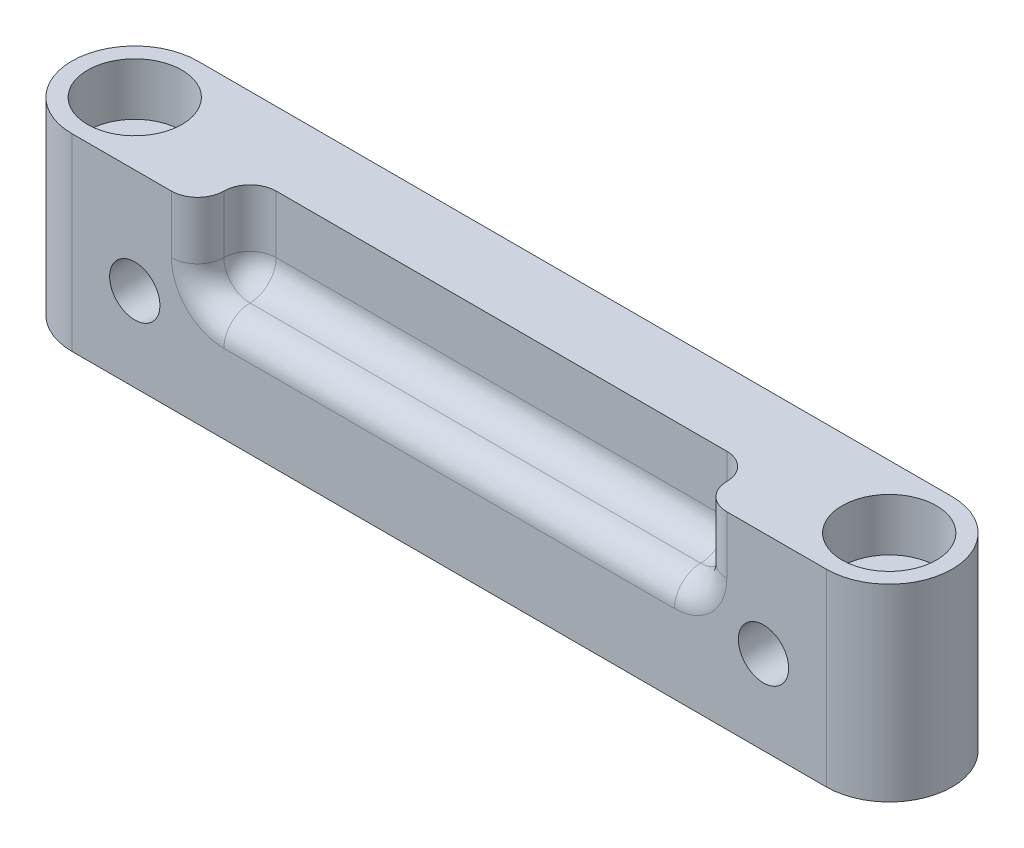
from build123d import *

# Parameters (mm, degrees)
SKETCH1_R           = 2.4
BOSS_EXTRUDE1_DEPTH = 9
SKETCH2_R           = 4.5
CUT_EXTRUDE1_DEPTH  = 5
SKETCH3_W           = 48
SKETCH3_H           = 5
CUT_EXTRUDE2_DEPTH  = 8
FILLET1_R           = 2.5
SKETCH4_R           = 2.4
CUT_EXTRUDE3_DEPTH  = 45.598206242


with BuildPart() as part:
    # Sketch1 → Boss-Extrude1 (new, symmetric)
    with BuildSketch(Plane(origin=(0, 0, 0), x_dir=(1, 0, 0), z_dir=(0, 1, 0))):
        with BuildLine():
            Line((36, -6), (-36, -6))
            ThreePointArc((-36, -6), (-42, 0), (-36, 6))
            Line((-36, 6), (36, 6))
            ThreePointArc((36, 6), (42, 0), (36, -6))
        make_face()
        with Locations(Location((-36, 0, 0), (0, 0, 270))):
            Circle(SKETCH1_R, mode=Mode.SUBTRACT)
        with Locations(Location((36, 0, 0), (0, 0, 270))):
            Circle(SKETCH1_R, mode=Mode.SUBTRACT)
    extrude(amount=BOSS_EXTRUDE1_DEPTH, both=True)

    # Sketch2 → Cut-Extrude1 (cut)
    with BuildSketch(Plane(origin=(0, 9, 0), x_dir=(1, 0, 0), z_dir=(0, 1, 0))):
        with Locations(Location((-36, 0, 0), (0, 0, 270))):
            Circle(SKETCH2_R)
        with Locations(Location((36, 0, 0), (0, 0, 270))):
            Circle(SKETCH2_R)
    extrude(amount=-CUT_EXTRUDE1_DEPTH, mode=Mode.SUBTRACT)

    # Sketch3 → Cut-Extrude2 (cut)
    with BuildSketch(Plane(origin=(0, 9, 0), x_dir=(1, 0, 0), z_dir=(0, 1, 0))):
        with Locations((0, -3.5)):
            Rectangle(SKETCH3_W, SKETCH3_H)
    extrude(amount=-CUT_EXTRUDE2_DEPTH, mode=Mode.SUBTRACT)

    # Fillet1
    fillet1_edges = [part.edges().sort_by_distance(p)[0] for p in [
        (-24, 1, 3.5),
        (-24, 5, 6),
        (0, 1, 1),
        (-24, 5, 1),
        (24, 1, 3.5),
        (24, 5, 1),
        (0, 1, 6),
        (24, 5, 6),
    ]]
    fillet(fillet1_edges, radius=FILLET1_R - 0.0001)  # a hair under: the kernel refuses the full size

    # Sketch4 → Cut-Extrude3 (cut, through all)
    with BuildSketch(Plane.XY.offset(6)):
        with Locations((-30, -1)):
            Circle(SKETCH4_R)
        with Locations((30, -1)):
            Circle(SKETCH4_R)
    extrude(amount=-CUT_EXTRUDE3_DEPTH, mode=Mode.SUBTRACT)


solid = part.part
